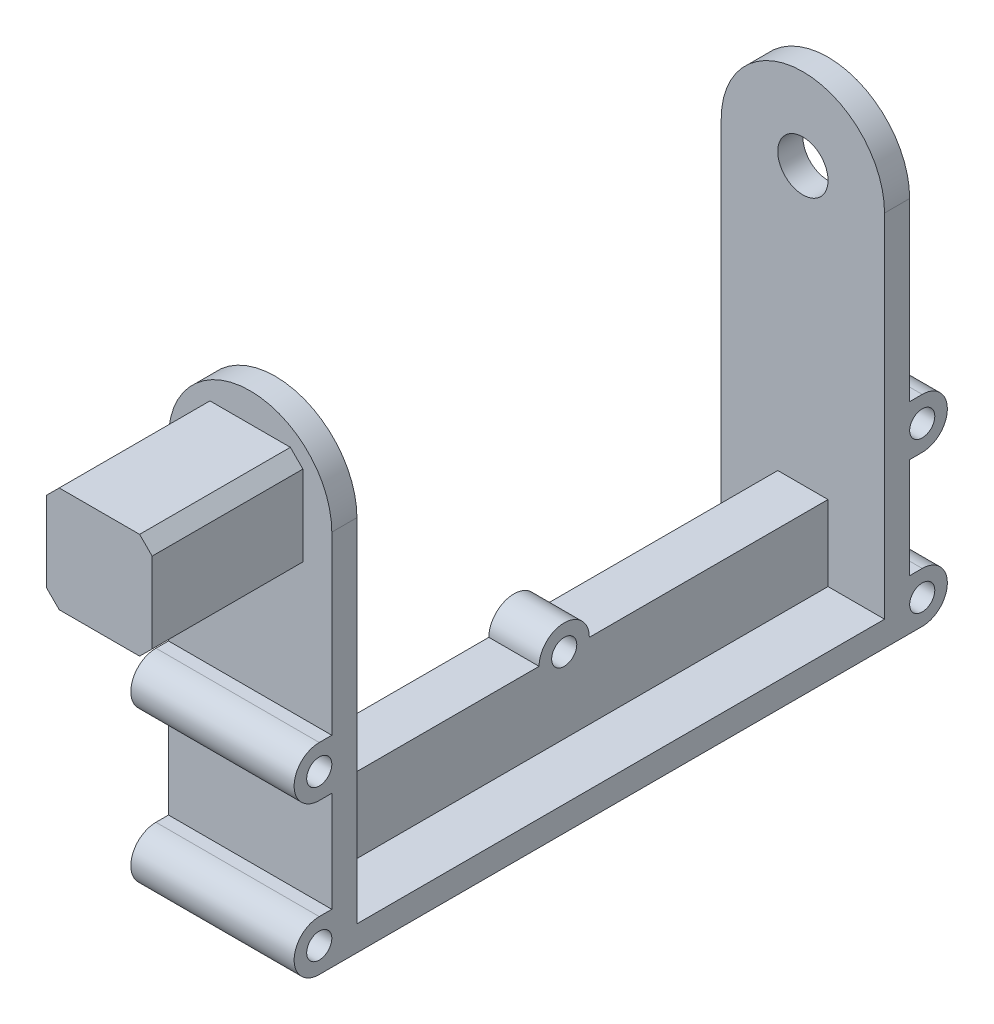
from build123d import *

# Parameters (mm, degrees)
BOSS_EXTRUDE1_DEPTH       = 10
SKETCH2_W                 = 65
SKETCH2_H                 = 10
BOSS_EXTRUDE2_DEPTH       = 105
SKETCH3_W                 = 42
SKETCH3_H                 = 42
BOSS_EXTRUDE3_DEPTH       = 60
CHAMFER1_SIZE             = 5
BOSS_EXTRUDE6_START       = -235
BOSS_EXTRUDE6_OUTLINE_W   = 65
BOSS_EXTRUDE6_OUTLINE_H   = 20
BOSS_EXTRUDE6_DEPTH       = 15
BOSS_EXTRUDE6_START_2     = 10
BOSS_EXTRUDE6_2_OUTLINE_W = 65
BOSS_EXTRUDE6_2_OUTLINE_H = 20
BOSS_EXTRUDE6_2_DEPTH     = 15
BOSS_EXTRUDE6_START_3     = -32.5
BOSS_EXTRUDE6_3_OUTLINE_R = 5
BOSS_EXTRUDE6_3_DEPTH     = 65
BOSS_EXTRUDE9_DEPTH       = 10
BOSS_EXTRUDE9_DEPTH_BACK  = 10
SKETCH5_R                 = 5


with BuildPart() as part:
    # Sketch1 → Boss-Extrude1 (new body)
    with BuildSketch(Plane.XY):
        with BuildLine():
            Line((32.5, -150), (32.5, 0))
            ThreePointArc((32.5, 0), (0, -32.5), (-32.5, 0))
            Line((-32.5, 0), (-32.5, -150))
            Line((-32.5, -150), (32.5, -150))
        make_face()
        with BuildLine():
            ThreePointArc((-10, 0), (0, 10), (10, 0))
            Line((10, 0), (32.5, 0))
            ThreePointArc((32.5, 0), (0, 32.5), (-32.5, 0))
            Line((-32.5, 0), (-10, 0))
        make_face()
        with BuildLine():
            Line((32.5, 0), (10, 0))
            ThreePointArc((10, 0), (0, -10), (-10, 0))
            Line((-10, 0), (-32.5, 0))
            ThreePointArc((-32.5, 0), (0, -32.5), (32.5, 0))
        make_face()
    extrude(amount=BOSS_EXTRUDE1_DEPTH)

    # Sketch2 → Boss-Extrude2 (add)
    with BuildSketch(Plane(origin=(0, 0, 0), x_dir=(-1, 0, 0), z_dir=(0, 0, -1))):
        with Locations((0, -145)):
            Rectangle(SKETCH2_W, SKETCH2_H)
    extrude(amount=BOSS_EXTRUDE2_DEPTH)

    # Mirror1: part across plane


with BuildPart() as part_1:
    add(part.part)
    add(part.part.mirror(Plane(origin=(0, 0, -105), x_dir=(1, 0, 0), z_dir=(0, 0, -1))))

    # Sketch3 → Boss-Extrude3 (add)
    with BuildSketch(Plane.XY.offset(10)):
        Rectangle(SKETCH3_W, SKETCH3_H)
    extrude(amount=BOSS_EXTRUDE3_DEPTH)

    # Chamfer1
    chamfer1_edges = [part_1.edges().sort_by_distance(p)[0] for p in [
        (-21, 21, 40),
        (-21, -21, 40),
        (21, -21, 40),
        (21, 21, 40),
    ]]
    chamfer(chamfer1_edges, length=CHAMFER1_SIZE)

    # Boss-Extrude6: read off the stored shape, not the designer's step
    # Boss-Extrude6 outline → Boss-Extrude6 (add)
    with BuildSketch(Plane.XY.offset(BOSS_EXTRUDE6_START)):
        with Locations((0, -140)):
            Rectangle(BOSS_EXTRUDE6_OUTLINE_W, BOSS_EXTRUDE6_OUTLINE_H)
        with Locations((0, -80)):
            Rectangle(BOSS_EXTRUDE6_OUTLINE_W, BOSS_EXTRUDE6_OUTLINE_H)
    extrude(amount=BOSS_EXTRUDE6_DEPTH)

    # Boss-Extrude6 2 outline → Boss-Extrude6 2 (add)
    with BuildSketch(Plane.XY.offset(BOSS_EXTRUDE6_START_2)):
        with Locations((0, -140)):
            Rectangle(BOSS_EXTRUDE6_2_OUTLINE_W, BOSS_EXTRUDE6_2_OUTLINE_H)
        with Locations((0, -80)):
            Rectangle(BOSS_EXTRUDE6_2_OUTLINE_W, BOSS_EXTRUDE6_2_OUTLINE_H)
    extrude(amount=BOSS_EXTRUDE6_2_DEPTH)

    # Boss-Extrude6 3 outline → Boss-Extrude6 3 (cut)
    with BuildSketch(Plane.YZ.offset(BOSS_EXTRUDE6_START_3)):
        with BuildLine():
            ThreePointArc((-90, 15), (-87.071067812, 22.071067812), (-80, 25))
            Line((-80, 25), (-90, 25))
            Line((-90, 25), (-90, 15))
        make_face()
        with BuildLine():
            ThreePointArc((-80, 25), (-72.928932188, 22.071067812), (-70, 15))
            Line((-70, 15), (-70, 25))
            Line((-70, 25), (-80, 25))
        make_face()
        with Locations((-80, 15)):
            Circle(BOSS_EXTRUDE6_3_OUTLINE_R)
        with BuildLine():
            ThreePointArc((-130, -225), (-132.928932188, -232.071067812), (-140, -235))
            Line((-140, -235), (-130, -235))
            Line((-130, -235), (-130, -225))
        make_face()
        with BuildLine():
            ThreePointArc((-140, -235), (-147.071067812, -232.071067812), (-150, -225))
            Line((-150, -225), (-150, -235))
            Line((-150, -235), (-140, -235))
        make_face()
        with BuildLine():
            ThreePointArc((-150, 15), (-147.071067812, 22.071067812), (-140, 25))
            Line((-140, 25), (-150, 25))
            Line((-150, 25), (-150, 15))
        make_face()
        with BuildLine():
            ThreePointArc((-140, 25), (-132.928932188, 22.071067812), (-130, 15))
            Line((-130, 15), (-130, 25))
            Line((-130, 25), (-140, 25))
        make_face()
        with Locations((-140, 15)):
            Circle(BOSS_EXTRUDE6_3_OUTLINE_R)
        with BuildLine():
            ThreePointArc((-70, -225), (-72.928932188, -232.071067812), (-80, -235))
            Line((-80, -235), (-70, -235))
            Line((-70, -235), (-70, -225))
        make_face()
        with BuildLine():
            ThreePointArc((-80, -235), (-87.071067812, -232.071067812), (-90, -225))
            Line((-90, -225), (-90, -235))
            Line((-90, -235), (-80, -235))
        make_face()
        with Locations((-80, -225)):
            Circle(BOSS_EXTRUDE6_3_OUTLINE_R)
        with Locations((-140, -225)):
            Circle(BOSS_EXTRUDE6_3_OUTLINE_R)
    extrude(amount=BOSS_EXTRUDE6_3_DEPTH, mode=Mode.SUBTRACT)

    # Sketch5 → Boss-Extrude9 (add, two sides: drawn at the far end of the back side and taken through both)
    with BuildSketch(Plane(origin=(0, 0, 0), x_dir=(0, 0, -1), z_dir=(1, 0, 0)).offset(-BOSS_EXTRUDE9_DEPTH_BACK)):
        with BuildLine():
            Line((95, -110), (0, -110))
            Line((0, -110), (0, -140))
            Line((0, -140), (210, -140))
            Line((210, -140), (210, -110))
            Line((210, -110), (115, -110))
            ThreePointArc((115, -110), (105, -100), (95, -110))
        make_face()
        with Locations((105, -110)):
            Circle(SKETCH5_R, mode=Mode.SUBTRACT)
    extrude(amount=BOSS_EXTRUDE9_DEPTH + BOSS_EXTRUDE9_DEPTH_BACK)


solid = part_1.part
